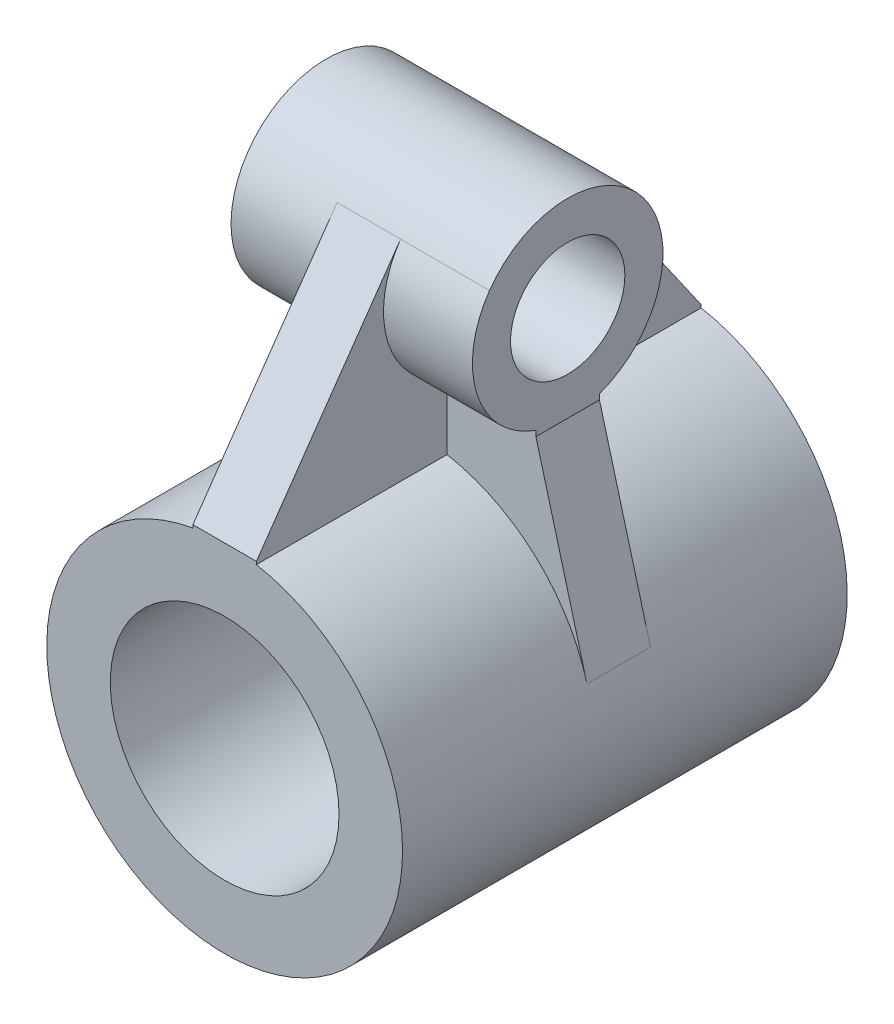
from build123d import *

# Parameters (mm, degrees)
SKETCH1_R               = 14
BOSS_EXTRUDE1_DEPTH     = 17.5
CUT_EXTRUDE1_DEPTH      = 27.424420523
CUT_EXTRUDE1_DEPTH_BACK = 27.424420523
SKETCH2_R               = 9
SKETCH3_R               = 7.5
BOSS_EXTRUDE2_DEPTH     = 9.5
CUT_EXTRUDE2_DEPTH      = 45.505617623
CUT_EXTRUDE2_DEPTH_BACK = 45.505617623
SKETCH4_R               = 4.5
BOSS_EXTRUDE3_DEPTH     = 2.5
RIB3_START              = -2.5
RIB3_DEPTH              = 5


with BuildPart() as part:
    # Sketch1 → Boss-Extrude1 (new, symmetric)
    with BuildSketch(Plane.XY):
        Circle(SKETCH1_R)
    extrude(amount=BOSS_EXTRUDE1_DEPTH, both=True)

    # Sketch2 → Cut-Extrude1 (cut, two sides: drawn at the far end of the back side and taken through both)
    with BuildSketch(Plane.XY.offset(-CUT_EXTRUDE1_DEPTH_BACK)):
        Circle(SKETCH2_R)
    extrude(amount=CUT_EXTRUDE1_DEPTH + CUT_EXTRUDE1_DEPTH_BACK, mode=Mode.SUBTRACT)



with BuildPart() as body_2:
    # Sketch3 → Boss-Extrude2 (new, symmetric)
    with BuildSketch(Plane(origin=(0, 0, 0), x_dir=(0, 0, -1), z_dir=(1, 0, 0))):
        with Locations((0, 26)):
            Circle(SKETCH3_R)
    extrude(amount=BOSS_EXTRUDE2_DEPTH, both=True)

    # Sketch4 → Cut-Extrude2 (cut, two sides: drawn at the far end of the back side and taken through both)
    with BuildSketch(Plane(origin=(9.5, 0, 0), x_dir=(0, 0, -1), z_dir=(1, 0, 0)).offset(-CUT_EXTRUDE2_DEPTH_BACK)):
        with Locations((0, 26)):
            Circle(SKETCH4_R)
    extrude(amount=CUT_EXTRUDE2_DEPTH + CUT_EXTRUDE2_DEPTH_BACK, mode=Mode.SUBTRACT)


with BuildPart() as part_1:
    add(part.part)

    add(body_2.part)  # Boss-Extrude3 merges body 2
    # Sketch5 → Boss-Extrude3 (add, symmetric)
    with BuildSketch(Plane(origin=(0, 0, 0), x_dir=(0, 0, -1), z_dir=(1, 0, 0))):
        with BuildLine():
            Line((-17.5, 14), (-6.153967777, 30.287036342))
            ThreePointArc((-6.153967777, 30.287036342), (-7.414340436, 27.130290186), (-7.151829247, 23.741385731))
            ThreePointArc((-7.151829247, 23.741385731), (-4.43341815, 19.950636107), (0, 18.5))
            ThreePointArc((0, 18.5), (4.056082014, 19.691418646), (6.823499563, 22.887147015))
            ThreePointArc((6.823499563, 22.887147015), (7.328923752, 24.407242442), (7.5, 26))
            ThreePointArc((7.5, 26), (7.155583775, 28.246691086), (6.153967777, 30.287036342))
            Line((6.153967777, 30.287036342), (17.5, 14))
            Line((17.5, 14), (17.5, 12.5))
            Line((17.5, 12.5), (-17.5, 12.5))
            Line((-17.5, 12.5), (-17.5, 14))
        make_face()
    extrude(amount=BOSS_EXTRUDE3_DEPTH, both=True)

    # Rib3: read off the stored shape, not the designer's step
    # Rib3 outline → Rib3 (add)
    with BuildSketch(Plane.XY.offset(RIB3_START)):
        with BuildLine():
            Line((9.5, 18.928932188), (2.5, 18.928932188))
            Line((2.5, 18.928932188), (2.5, 13.774977314))
            ThreePointArc((2.5, 13.774977314), (9.472147799, 10.309142354), (13.514557534, 3.654686672))
            Line((13.514557534, 3.654686672), (9.5, 18.5))
            Line((9.5, 18.5), (9.5, 18.928932188))
        make_face()
    extrude(amount=RIB3_DEPTH)


solid = part_1.part
